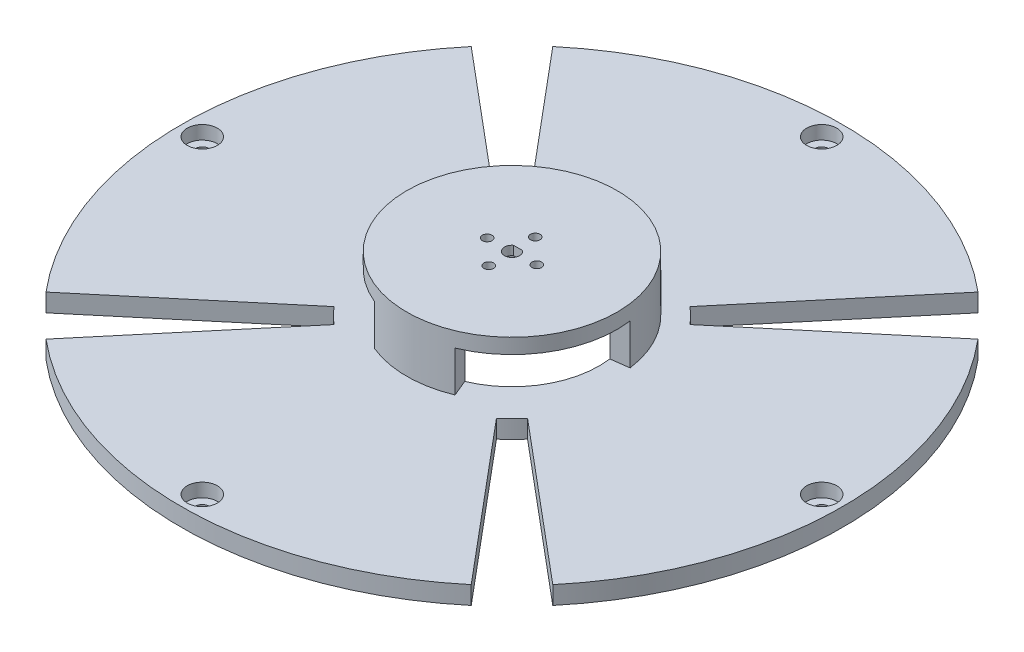
from build123d import *

# Parameters (mm, degrees)
SCHIZZO1_W                                          = 81
SCHIZZO1_H                                          = 6
ESTRUSIONE_ESTRUSIONE2_START                        = 13.5
ESTRUSIONE_ESTRUSIONE2_DEPTH                        = 13.5
ESTRUSIONE_ESTRUSIONE3_START                        = 5
SCHIZZO4_R                                          = 35
ESTRUSIONE_ESTRUSIONE3_DEPTH                        = 5
TAGLIA_RIVOLUZIONE2_DEPTH                           = 6
RIPETIZIONECIRCOLARE1_COUNT                         = 4
SCHIZZO6_R                                          = 11
TAGLIO_ESTRUSIONE2_DEPTH                            = 2
SCHIZZO7_R                                          = 1.6
TAGLIO_ESTRUSIONE3_DEPTH                            = 22
FORO_LAMATO_PER_VITE_M4_A_TESTA_SOTTILE_D           = 4.5
FORO_LAMATO_PER_VITE_M4_A_TESTA_SOTTILE_DEPTH       = 9
FORO_LAMATO_PER_VITE_M4_A_TESTA_SOTTILE_CBORE_D     = 10
FORO_LAMATO_PER_VITE_M4_A_TESTA_SOTTILE_CBORE_DEPTH = 4.5
FORO_LAMATO_PER_VITE_M4_A_TESTA_SOTTILE_TIP         = 1.351936393


# Read off the part's stored shape, not the designer's step: Taglia-Rivoluzione2
with BuildPart() as part:
    # Schizzo1 → Rivoluzione1 (revolve)
    with BuildSketch(Plane.XY):
        with Locations((-69.5, 3)):
            Rectangle(SCHIZZO1_W, SCHIZZO1_H)
    revolve(axis=Axis((0, 30.5, 0), (0, -1, 0)))

    # Schizzo3 → Estrusione-Estrusione2 (add)
    with BuildSketch(Plane(origin=(0, 6, 0), x_dir=(1, 0, 0), z_dir=(0, 1, 0)).offset(ESTRUSIONE_ESTRUSIONE2_START)):
        with BuildLine():
            Line((21.306650015, 27.76736691), (17.654081441, 23.007246868))
            ThreePointArc((17.654081441, 23.007246868), (25.11473671, 14.5), (28.75190098, 3.785259574))
            Line((28.75190098, 3.785259574), (34.700570148, 4.568416728))
            ThreePointArc((34.700570148, 4.568416728), (30.310889132, 17.5), (21.306650015, 27.76736691))
        make_face()
        with BuildLine():
            ThreePointArc((-21.306650015, 27.76736691), (-30.310889132, 17.5), (-34.700570148, 4.568416728))
            Line((-34.700570148, 4.568416728), (-28.75190098, 3.785259574))
            ThreePointArc((-28.75190098, 3.785259574), (-25.11473671, 14.5), (-17.654081441, 23.007246868))
            Line((-17.654081441, 23.007246868), (-21.306650015, 27.76736691))
        make_face()
        with BuildLine():
            ThreePointArc((-13.393920133, -32.335783638), (0, -35), (13.393920133, -32.335783638))
            Line((13.393920133, -32.335783638), (11.097819539, -26.792506443))
            ThreePointArc((11.097819539, -26.792506443), (0, -29), (-11.097819539, -26.792506443))
            Line((-11.097819539, -26.792506443), (-13.393920133, -32.335783638))
        make_face()
    extrude(amount=-ESTRUSIONE_ESTRUSIONE2_DEPTH)

    # Schizzo4 → Estrusione-Estrusione3 (add)
    with BuildSketch(Plane(origin=(0, 19.5, 0), x_dir=(1, 0, 0), z_dir=(0, 1, 0)).offset(ESTRUSIONE_ESTRUSIONE3_START)):
        with Locations(Location((0, 0, 0), (0, 0, 7.5))):
            Circle(SCHIZZO4_R)
    extrude(amount=-ESTRUSIONE_ESTRUSIONE3_DEPTH)

    # Taglia-Rivoluzione2 outline → Taglia-Rivoluzione2 (cut)
    with BuildSketch(Plane(origin=(0, 0, 0), x_dir=(1, 0, 0), z_dir=(0, 1, 0))):
        with BuildLine():
            Line((-84.264888743, 70.706637066), (-32.173866611, 26.997079607))
            ThreePointArc((-32.173866611, 26.997079607), (-29.69848481, 29.69848481), (-26.997079607, 32.173866611))
            Line((-26.997079607, 32.173866611), (-70.706637066, 84.264888743))
            ThreePointArc((-70.706637066, 84.264888743), (-77.781745931, 77.781745931), (-84.264888743, 70.706637066))
        make_face()
    taglia_rivoluzione2 = extrude(amount=TAGLIA_RIVOLUZIONE2_DEPTH, mode=Mode.SUBTRACT)

    # RipetizioneCircolare1: Taglia-Rivoluzione2 ×4 about axis
    ripetizionecircolare1_axis = Axis((0, 6, 0), (0, 1, 0))
    for i in range(1, RIPETIZIONECIRCOLARE1_COUNT):
        add(taglia_rivoluzione2.rotate(ripetizionecircolare1_axis, i * 360 / RIPETIZIONECIRCOLARE1_COUNT), mode=Mode.SUBTRACT)

    # Schizzo6 → Taglio-Estrusione2 (cut)
    with BuildSketch(Plane.XZ.offset(-19.5)):
        Circle(SCHIZZO6_R)
    extrude(amount=-TAGLIO_ESTRUSIONE2_DEPTH, mode=Mode.SUBTRACT)

    # Schizzo7 → Taglio-Estrusione3 (cut)
    with BuildSketch(Plane.XZ.offset(-21.5)):
        with Locations((-7.995791255, 0.259465219)):
            Circle(SCHIZZO7_R)
        with Locations((0.259465219, 7.995791255)):
            Circle(SCHIZZO7_R)
        with Locations((7.995791255, -0.259465219)):
            Circle(SCHIZZO7_R)
        with Locations((-0.259465219, -7.995791255)):
            Circle(SCHIZZO7_R)
        with BuildLine():
            Line((-1.5, -2), (1.5, -2))
            ThreePointArc((1.5, -2), (0, 2.5), (-1.5, -2))
        make_face()
    extrude(amount=-TAGLIO_ESTRUSIONE3_DEPTH, mode=Mode.SUBTRACT)

    # Foro lamato per Vite M4 a testa sottile cilindrica1
    with Locations(Plane(origin=(0, 6, 0), x_dir=(1, 0, 0), z_dir=(0, 1, 0))):
        with Locations((-103, 0), (103, 0), (0, 103), (0, -103)):
            CounterBoreHole(FORO_LAMATO_PER_VITE_M4_A_TESTA_SOTTILE_D / 2, FORO_LAMATO_PER_VITE_M4_A_TESTA_SOTTILE_CBORE_D / 2, FORO_LAMATO_PER_VITE_M4_A_TESTA_SOTTILE_CBORE_DEPTH, depth=FORO_LAMATO_PER_VITE_M4_A_TESTA_SOTTILE_DEPTH)
            with Locations((0, 0, -(FORO_LAMATO_PER_VITE_M4_A_TESTA_SOTTILE_DEPTH + FORO_LAMATO_PER_VITE_M4_A_TESTA_SOTTILE_TIP / 2))):  # 118° drill point
                Cone(0, FORO_LAMATO_PER_VITE_M4_A_TESTA_SOTTILE_D / 2, FORO_LAMATO_PER_VITE_M4_A_TESTA_SOTTILE_TIP, mode=Mode.SUBTRACT)


solid = part.part
